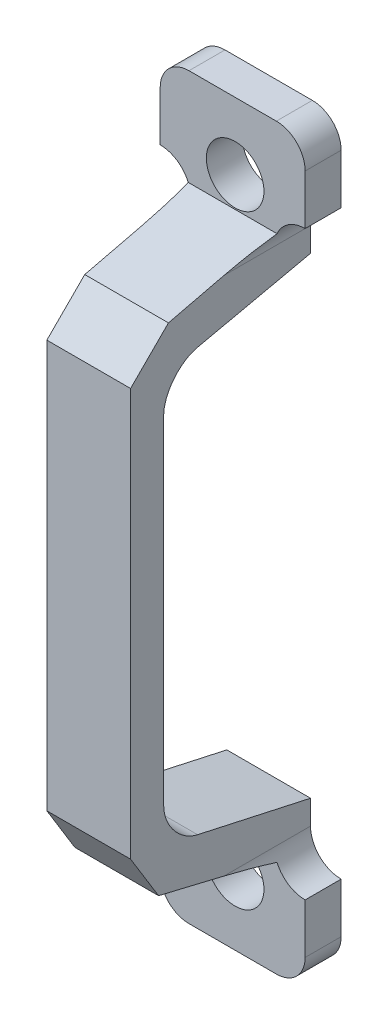
from build123d import *
from OCP.BRepFilletAPI import BRepFilletAPI_MakeChamfer

# Parameters (mm, degrees)
SKETCH_1_W               = 10.068208361
SKETCH_1_H               = 51.310344827
SKETCH_1_R               = 2
EXTRUDE_1_DEPTH          = 2.5
EXTRUDE_2_DEPTH          = 10.068208362
CUT_EXTRUDE_1_DEPTH      = 83.243670079
CUT_EXTRUDE_1_DEPTH_BACK = 83.243670079
CUT_EXTRUDE_2_DEPTH      = 122.121367623
CUT_EXTRUDE_2_DEPTH_BACK = 122.121367623
FILLET_2_R               = 2
CHAMFER_2_SIZE           = 2
CHAMFER_2_SIZE2          = 2.70532723


with BuildPart() as part:
    # 草图1 → 凸台-拉伸1 (new body)
    with BuildSketch(Plane.XY):
        with Locations((84.451834639, -55.007101597)):
            Rectangle(SKETCH_1_W, SKETCH_1_H)
        with Locations((84.623869854, -34.007101596)):
            Circle(SKETCH_1_R, mode=Mode.SUBTRACT)
        with Locations((84.623869854, -76.007101596)):
            Circle(SKETCH_1_R, mode=Mode.SUBTRACT)
    extrude(amount=EXTRUDE_1_DEPTH)

    # 草图2 → 凸台-拉伸2 (add)
    with BuildSketch(Plane(origin=(89.485938819, 0, 0), x_dir=(0, 0, -1), z_dir=(1, 0, 0))):
        Polygon((-12.5, -71.517171054), (-2.5, -73.914822505), (-2.5, -36.099380688), (-12.5, -38.497032139), align=None)
    extrude(amount=-EXTRUDE_2_DEPTH)

    # 草图3 → 切除-拉伸1 (cut, two sides: drawn at the far end of the back side and taken through both)
    with BuildSketch(Plane(origin=(89.485938819, 0, 0), x_dir=(0, 0, -1), z_dir=(1, 0, 0)).offset(-CUT_EXTRUDE_1_DEPTH_BACK)):
        Polygon((-10.198786391, -69.151033694), (0, -71.395312685), (0, -38.618890508), (-10.198786391, -40.863169498), align=None)
    extrude(amount=CUT_EXTRUDE_1_DEPTH + CUT_EXTRUDE_1_DEPTH_BACK, mode=Mode.SUBTRACT)

    # 草图4 → 切除-拉伸2 (cut, two sides: drawn at the far end of the back side and taken through both)
    with BuildSketch(Plane.XY.offset(12.5).offset(-CUT_EXTRUDE_2_DEPTH_BACK)):
        with BuildLine():
            Line((81.544440974, -36.941486908), (81.544440974, -73.072716285))
            ThreePointArc((81.544440974, -73.072716285), (79.417730458, -75.199426802), (77.291019941, -73.072716285))
            Line((77.291019941, -73.072716285), (77.291019941, -36.941486908))
            ThreePointArc((77.291019941, -36.941486908), (79.417730458, -34.814776391), (81.544440974, -36.941486908))
        make_face()
        with BuildLine():
            Line((87.359228302, -36.941486908), (87.359228302, -73.072716285))
            ThreePointArc((87.359228302, -73.072716285), (89.485938819, -75.199426802), (91.612649336, -73.072716285))
            Line((91.612649336, -73.072716285), (91.612649336, -36.941486908))
            ThreePointArc((91.612649336, -36.941486908), (89.485938819, -34.814776391), (87.359228302, -36.941486908))
        make_face()
    extrude(amount=CUT_EXTRUDE_2_DEPTH + CUT_EXTRUDE_2_DEPTH_BACK, mode=Mode.SUBTRACT)

    # 圆角1
    # a fillet whose section is not a circle: 3 mm, written as the material it adds along each edge
    with BuildSketch(Plane(origin=(87.359228302, -40.863169498, 10.198786391), x_dir=(0, 0.2149116520268582, -0.9766334941128564), z_dir=(-1, 0, 0)), Plane(origin=(87.359228302, -69.151033694, 10.198786391), x_dir=(0, 1, 0), z_dir=(-1, 0, 0))) as fillet_1_piece_1:
        with BuildLine():
            Bezier((2.411616085, 0), (0, 0), (-0.518284397, 2.355265044), weights=[1, 0.666666667, 1])
            Line((-0.518284397, 2.355265044), (0, 0))
            Line((0, 0), (2.411616085, 0))
        make_face()
    extrude(amount=5.814787328)

    # 圆角2
    fillet_2_edges = [part.edges().sort_by_distance(p)[0] for p in [
        (89.485938819, -80.66227401, 1.25),
        (79.417730458, -80.66227401, 1.25),
        (79.417730458, -29.351929183, 1.25),
        (89.485938819, -29.351929183, 1.25),
    ]]
    fillet(fillet_2_edges, radius=FILLET_2_R)

    # 倒角2: one chamfer whose edges measure the first distance from different faces: ONE call of the kernel's chamfer builder (chamfer() names one face for all edges)
    chamfer_2_edges_1 = [part.edges().sort_by_distance(p)[0] for p in [
        (84.451834638, -71.517171054, 12.5),
    ]]
    chamfer_2_side_1 = [part.faces().sort_by_distance(p)[0] for p in [
        (84.451834638, -72.722762821, 7.471780545),
    ]]
    chamfer_2_edges_2 = [part.edges().sort_by_distance(p)[0] for p in [
        (84.451834638, -38.497032139, 12.5),
    ]]
    chamfer_2_side_2 = [part.faces().sort_by_distance(p)[0] for p in [
        (84.451834638, -55.007101596, 12.5),
    ]]
    chamfer_2 = BRepFilletAPI_MakeChamfer(part.part.solid().wrapped)
    for e in chamfer_2_edges_1:
        chamfer_2.Add(CHAMFER_2_SIZE, CHAMFER_2_SIZE2, e.wrapped, chamfer_2_side_1[0].wrapped)  # the first distance lies on this face
    for e in chamfer_2_edges_2:
        chamfer_2.Add(CHAMFER_2_SIZE, CHAMFER_2_SIZE2, e.wrapped, chamfer_2_side_2[0].wrapped)  # the first distance lies on this face
    add(Compound.cast(chamfer_2.Shape()), mode=Mode.REPLACE)


solid = part.part
